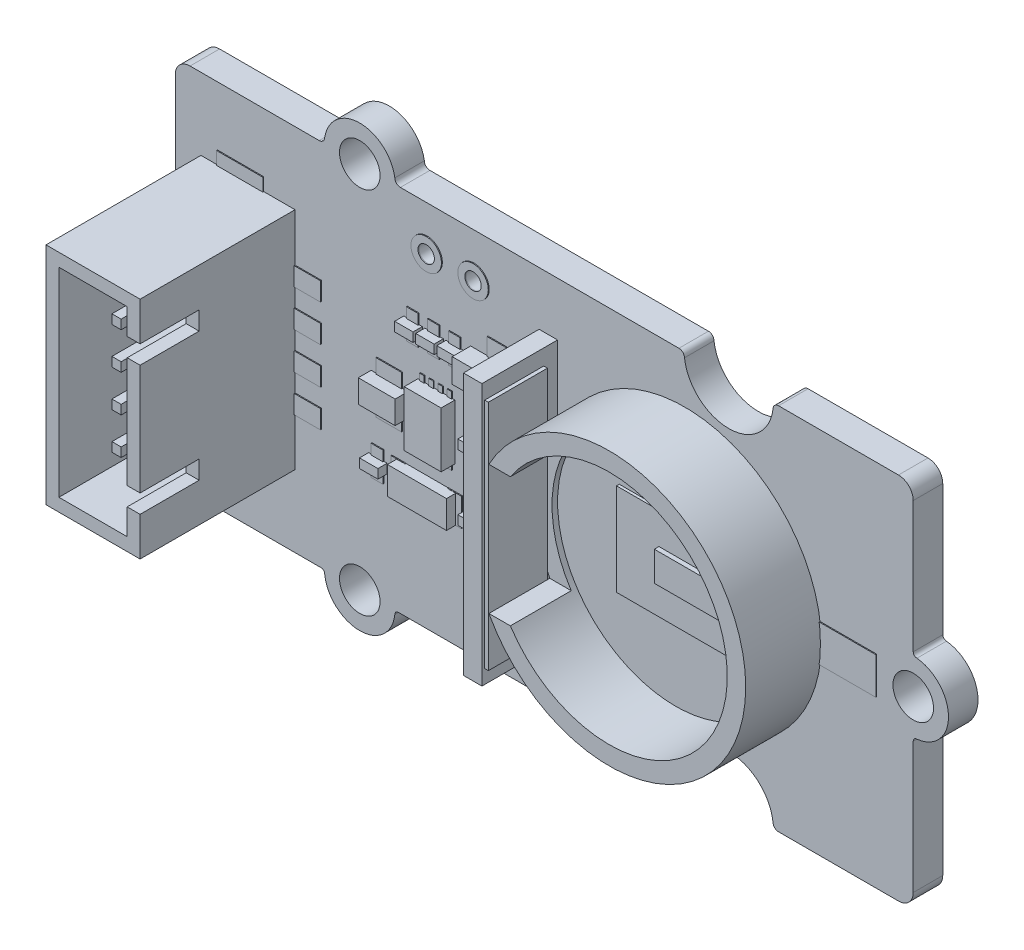
from build123d import *

# Parameters (mm, degrees)
ESQUISSE1_R                                    = 1.1
ESQUISSE1_R_2                                  = 1.100000001
ESQUISSE1_R_3                                  = 0.75
ESQUISSE1_R_4                                  = 0.4445
PCB_CONTOUR_ET_PERCAGES_EAGLE_EP_ESTIMEE_DEPTH = 1.6
CONNECTEUR_GROVE_H_ESTIMEE_START               = 1.6
ESQUISSE2_W                                    = 5.1
ESQUISSE2_H                                    = 12.2
CONNECTEUR_GROVE_H_ESTIMEE_DEPTH               = 8.4
CAVITE_GROVE_START                             = 10
ESQUISSE3_W                                    = 3.7
ESQUISSE3_H                                    = 10.8
CAVITE_GROVE_DEPTH                             = 7.3
DETROMPEURS_SIMPLIFIES_START                   = 10
ESQUISSE4_W                                    = 1
ESQUISSE4_H                                    = 1
DETROMPEURS_SIMPLIFIES_DEPTH                   = 3.2
BROCHES_GROVE_PAS2_START                       = 2.7
ESQUISSE5_W                                    = 0.5
ESQUISSE5_H                                    = 0.5
BROCHES_GROVE_PAS2_DEPTH                       = 5.9
BROCHES_GROVE_PAS2_2_DEPTH                     = 5.9
BROCHES_GROVE_PAS2_3_DEPTH                     = 5.9
BROCHES_GROVE_PAS2_4_DEPTH                     = 5.9
SUPPORT_PILE_CONTOUR_EAGLE_H4_1_START          = 1.6
ESQUISSE6_R                                    = 7.4
ESQUISSE6_R_2                                  = 6.4
SUPPORT_PILE_CONTOUR_EAGLE_H4_1_DEPTH          = 4.1
OUVERTURE_SUPPORT_ESTIMEE_START                = 5.7
ESQUISSE7_W                                    = 4
ESQUISSE7_H                                    = 7
OUVERTURE_SUPPORT_ESTIMEE_DEPTH                = 3.3
FOND_SUPPORT_SIMPLIFIE_START                   = 1.6
ESQUISSE8_R                                    = 6.4
FOND_SUPPORT_SIMPLIFIE_DEPTH                   = 0.5
DOS_SUPPORT_PILE_ESTIME_START                  = 1.6
ESQUISSE9_W                                    = 1
ESQUISSE9_H                                    = 14.2
DOS_SUPPORT_PILE_ESTIME_DEPTH                  = 4.1
CONTACT_POSITIF_SUPPORT_SIMPLIFIE_START        = 2.4
ESQUISSE10_W                                   = 0.2
ESQUISSE10_H                                   = 12.6
CONTACT_POSITIF_SUPPORT_SIMPLIFIE_DEPTH        = 3.2
CONTACT_FOND_SUPPORT_SIMPLIFIE_START           = 2.1
ESQUISSE11_W                                   = 7.7
ESQUISSE11_H                                   = 5
CONTACT_FOND_SUPPORT_SIMPLIFIE_DEPTH           = 0.15
LAME_RESSORT_SIMPLIFIEE_START                  = 2.25
ESQUISSE12_W                                   = 4.5
ESQUISSE12_H                                   = 1.6
LAME_RESSORT_SIMPLIFIEE_DEPTH                  = 0.25
X1_POSITION_EAGLE_START                        = 1.6
ESQUISSE13_W                                   = 3.2
ESQUISSE13_H                                   = 1.5
X1_POSITION_EAGLE_DEPTH                        = 0.55
U2_POSITION_EAGLE_START                        = 1.6
ESQUISSE14_W                                   = 2
ESQUISSE14_H                                   = 3
U2_POSITION_EAGLE_DEPTH                        = 0.75
C1_POSITION_EAGLE_START                        = 1.6
ESQUISSE15_W                                   = 1
ESQUISSE15_H                                   = 0.5
C1_POSITION_EAGLE_DEPTH                        = 0.5
C3_POSITION_EAGLE_START                        = 1.6
ESQUISSE16_W                                   = 1
ESQUISSE16_H                                   = 0.5
C3_POSITION_EAGLE_DEPTH                        = 0.5
R1_POSITION_EAGLE_START                        = 1.6
ESQUISSE17_W                                   = 1
ESQUISSE17_H                                   = 0.5
R1_POSITION_EAGLE_DEPTH                        = 0.5
R3_POSITION_EAGLE_START                        = 1.6
ESQUISSE18_W                                   = 1
ESQUISSE18_H                                   = 0.5
R3_POSITION_EAGLE_DEPTH                        = 0.5
U1_POSITION_EAGLE_START                        = 1.6
ESQUISSE19_W                                   = 2.9
ESQUISSE19_H                                   = 1.3
U1_POSITION_EAGLE_DEPTH                        = 1
C2_POSITION_EAGLE_START                        = 1.6
ESQUISSE20_W                                   = 1
ESQUISSE20_H                                   = 0.5
C2_POSITION_EAGLE_DEPTH                        = 0.5
R2_POSITION_EAGLE_START                        = 1.6
ESQUISSE21_W                                   = 1
ESQUISSE21_H                                   = 0.5
R2_POSITION_EAGLE_DEPTH                        = 0.5
C4_POSITION_EAGLE_START                        = 1.6
ESQUISSE22_W                                   = 2
ESQUISSE22_H                                   = 1.25
C4_POSITION_EAGLE_DEPTH                        = 0.7
PAD_X1_0_START                                 = 1.6
ESQUISSE23_W                                   = 0.762
ESQUISSE23_H                                   = 1.524
PAD_X1_0_DEPTH                                 = 0.05
PAD_X1_1_START                                 = 1.6
ESQUISSE24_W                                   = 0.762
ESQUISSE24_H                                   = 1.524
PAD_X1_1_DEPTH                                 = 0.05
PAD_J1_0_START                                 = 1.6
ESQUISSE25_W                                   = 2.5
ESQUISSE25_H                                   = 1
PAD_J1_0_DEPTH                                 = 0.05
PAD_J1_1_START                                 = 1.6
ESQUISSE26_W                                   = 2.5
ESQUISSE26_H                                   = 1
PAD_J1_1_DEPTH                                 = 0.05
PAD_J1_2_START                                 = 1.6
ESQUISSE27_W                                   = 2.5
ESQUISSE27_H                                   = 1
PAD_J1_2_DEPTH                                 = 0.05
PAD_J1_3_START                                 = 1.6
ESQUISSE28_W                                   = 2.5
ESQUISSE28_H                                   = 1
PAD_J1_3_DEPTH                                 = 0.05
PAD_J1_4_START                                 = 1.6
ESQUISSE29_W                                   = 2.5
ESQUISSE29_H                                   = 2
PAD_J1_4_DEPTH                                 = 0.05
PAD_J1_5_START                                 = 1.6
ESQUISSE30_W                                   = 2.5
ESQUISSE30_H                                   = 2
PAD_J1_5_DEPTH                                 = 0.05
PAD_U2_0_START                                 = 1.6
ESQUISSE31_W                                   = 0.25
ESQUISSE31_H                                   = 0.7
PAD_U2_0_DEPTH                                 = 0.05
PAD_U2_1_START                                 = 1.6
ESQUISSE32_W                                   = 0.25
ESQUISSE32_H                                   = 0.7
PAD_U2_1_DEPTH                                 = 0.05
PAD_U2_2_START                                 = 1.6
ESQUISSE33_W                                   = 0.25
ESQUISSE33_H                                   = 0.7
PAD_U2_2_DEPTH                                 = 0.05
PAD_U2_3_START                                 = 1.6
ESQUISSE34_W                                   = 0.25
ESQUISSE34_H                                   = 0.7
PAD_U2_3_DEPTH                                 = 0.05
PAD_U2_4_START                                 = 1.6
ESQUISSE35_W                                   = 0.25
ESQUISSE35_H                                   = 0.7
PAD_U2_4_DEPTH                                 = 0.05
PAD_U2_5_START                                 = 1.6
ESQUISSE36_W                                   = 0.25
ESQUISSE36_H                                   = 0.7
PAD_U2_5_DEPTH                                 = 0.05
PAD_U2_6_START                                 = 1.6
ESQUISSE37_W                                   = 0.25
ESQUISSE37_H                                   = 0.7
PAD_U2_6_DEPTH                                 = 0.05
PAD_U2_7_START                                 = 1.6
ESQUISSE38_W                                   = 0.25
ESQUISSE38_H                                   = 0.7
PAD_U2_7_DEPTH                                 = 0.05
PAD_U2_8_START                                 = 1.6
ESQUISSE39_W                                   = 1.5
ESQUISSE39_H                                   = 1.5
PAD_U2_8_DEPTH                                 = 0.05
PAD_C1_0_START                                 = 1.6
ESQUISSE40_W                                   = 0.635
ESQUISSE40_H                                   = 0.635
PAD_C1_0_DEPTH                                 = 0.05
PAD_C1_1_START                                 = 1.6
ESQUISSE41_W                                   = 0.635
ESQUISSE41_H                                   = 0.635
PAD_C1_1_DEPTH                                 = 0.05
PAD_C3_0_START                                 = 1.6
ESQUISSE42_W                                   = 0.635
ESQUISSE42_H                                   = 0.635
PAD_C3_0_DEPTH                                 = 0.05
PAD_C3_1_START                                 = 1.6
ESQUISSE43_W                                   = 0.635
ESQUISSE43_H                                   = 0.635
PAD_C3_1_DEPTH                                 = 0.05
PAD_R1_0_START                                 = 1.6
ESQUISSE44_W                                   = 0.635
ESQUISSE44_H                                   = 0.635
PAD_R1_0_DEPTH                                 = 0.05
PAD_R1_1_START                                 = 1.6
ESQUISSE45_W                                   = 0.635
ESQUISSE45_H                                   = 0.635
PAD_R1_1_DEPTH                                 = 0.05
PAD_R3_0_START                                 = 1.6
ESQUISSE46_W                                   = 0.635
ESQUISSE46_H                                   = 0.635
PAD_R3_0_DEPTH                                 = 0.05
PAD_R3_1_START                                 = 1.6
ESQUISSE47_W                                   = 0.635
ESQUISSE47_H                                   = 0.635
PAD_R3_1_DEPTH                                 = 0.05
PAD_U1_0_START                                 = 1.6
ESQUISSE48_W                                   = 1.016
ESQUISSE48_H                                   = 1.143
PAD_U1_0_DEPTH                                 = 0.05
PAD_U1_1_START                                 = 1.6
ESQUISSE49_W                                   = 1.016
ESQUISSE49_H                                   = 1.143
PAD_U1_1_DEPTH                                 = 0.05
PAD_U1_2_START                                 = 1.6
ESQUISSE50_W                                   = 1.016
ESQUISSE50_H                                   = 1.143
PAD_U1_2_DEPTH                                 = 0.05
PAD_C2_0_START                                 = 1.6
ESQUISSE51_W                                   = 0.635
ESQUISSE51_H                                   = 0.635
PAD_C2_0_DEPTH                                 = 0.05
PAD_C2_1_START                                 = 1.6
ESQUISSE52_W                                   = 0.635
ESQUISSE52_H                                   = 0.635
PAD_C2_1_DEPTH                                 = 0.05
PAD_R2_0_START                                 = 1.6
ESQUISSE53_W                                   = 0.635
ESQUISSE53_H                                   = 0.635
PAD_R2_0_DEPTH                                 = 0.05
PAD_R2_1_START                                 = 1.6
ESQUISSE54_W                                   = 0.635
ESQUISSE54_H                                   = 0.635
PAD_R2_1_DEPTH                                 = 0.05
PAD_BAT1_0_START                               = 1.6
ESQUISSE55_W                                   = 4.4
ESQUISSE55_H                                   = 2
PAD_BAT1_0_DEPTH                               = 0.05
PAD_BAT1_1_START                               = 1.6
ESQUISSE56_W                                   = 4.4
ESQUISSE56_H                                   = 2
PAD_BAT1_1_DEPTH                               = 0.05
PAD_C4_0_START                                 = 1.6
ESQUISSE57_W                                   = 1.397
ESQUISSE57_H                                   = 1.016
PAD_C4_0_DEPTH                                 = 0.05
PAD_C4_1_START                                 = 1.6
ESQUISSE58_W                                   = 1.397
ESQUISSE58_H                                   = 1.016
PAD_C4_1_DEPTH                                 = 0.05
ANNEAUX_CLK_INT_START                          = 1.6
ESQUISSE59_R                                   = 0.8255
ESQUISSE59_R_2                                 = 0.4445
ANNEAUX_CLK_INT_DEPTH                          = 0.05
ANNEAUX_CLK_INT_2_DEPTH                        = 0.05


with BuildPart() as part:
    # Esquisse1 → PCB_contour_et_percages_Eagle_ep_ESTIMEE_1_6 (new body)
    with BuildSketch(Plane.XY):
        with BuildLine():
            Line((20.635, -9.2), (20.635, -2.1))
            ThreePointArc((20.635, -2.1), (20.693578644, -1.958578644), (20.835, -1.9))
            ThreePointArc((20.835, -1.9), (22.545497316, 0), (20.835, 1.9))
            ThreePointArc((20.835, 1.9), (20.693578644, 1.958578644), (20.635, 2.1))
            Line((20.635, 2.1), (20.635, 9.2))
            ThreePointArc((20.635, 9.2), (20.400685425, 9.765685425), (19.835, 10))
            Line((19.835, 10), (13.335, 10))
            ThreePointArc((13.335, 10), (13.122867966, 9.912132034), (13.035, 9.7))
            ThreePointArc((13.035, 9.7), (10.635, 7.581322681), (8.235, 9.7))
            ThreePointArc((8.235, 9.7), (8.147132034, 9.912132034), (7.935, 10))
            Line((7.935, 10), (-7.165, 10))
            ThreePointArc((-7.165, 10), (-7.377132034, 10.087867966), (-7.465, 10.3))
            ThreePointArc((-7.465, 10.3), (-9.365, 11.923538409), (-11.265, 10.3))
            ThreePointArc((-11.265, 10.3), (-11.352867966, 10.087867966), (-11.565, 10))
            Line((-11.565, 10), (-18.565, 10))
            ThreePointArc((-18.565, 10), (-19.130685425, 9.765685425), (-19.365, 9.2))
            Line((-19.365, 9.2), (-19.365, 2.7))
            ThreePointArc((-19.365, 2.7), (-19.277132034, 2.487867966), (-19.065, 2.4))
            ThreePointArc((-19.065, 2.4), (-16.946322681, 0), (-19.065, -2.4))
            ThreePointArc((-19.065, -2.4), (-19.277132034, -2.487867966), (-19.365, -2.7))
            Line((-19.365, -2.7), (-19.365, -9.2))
            ThreePointArc((-19.365, -9.2), (-19.130685425, -9.765685425), (-18.565, -10))
            Line((-18.565, -10), (-11.465, -10))
            ThreePointArc((-11.465, -10), (-11.323578644, -10.058578644), (-11.265, -10.2))
            ThreePointArc((-11.265, -10.2), (-9.365, -11.910497316), (-7.465, -10.2))
            ThreePointArc((-7.465, -10.2), (-7.406421356, -10.058578644), (-7.265, -10))
            Line((-7.265, -10), (7.935, -10))
            ThreePointArc((7.935, -10), (8.147132034, -9.912132034), (8.235, -9.7))
            ThreePointArc((8.235, -9.7), (10.635, -7.581322681), (13.035, -9.7))
            ThreePointArc((13.035, -9.7), (13.122867966, -9.912132034), (13.335, -10))
            Line((13.335, -10), (19.835, -10))
            ThreePointArc((19.835, -10), (20.400685425, -9.765685425), (20.635, -9.2))
        make_face()
        with Locations((-9.365, -9.999999999)):
            Circle(ESQUISSE1_R, mode=Mode.SUBTRACT)
        with Locations((-9.365, 10.000000004)):
            Circle(ESQUISSE1_R, mode=Mode.SUBTRACT)
        with Locations((20.634999999, 0)):
            Circle(ESQUISSE1_R_2, mode=Mode.SUBTRACT)
        with Locations((4.555, 0)):
            Circle(ESQUISSE1_R_3, mode=Mode.SUBTRACT)
        with Locations((11.955, 0)):
            Circle(ESQUISSE1_R_3, mode=Mode.SUBTRACT)
        with Locations((-3.175, 7.62)):
            Circle(ESQUISSE1_R_4, mode=Mode.SUBTRACT)
        with Locations((-5.715, 7.62)):
            Circle(ESQUISSE1_R_4, mode=Mode.SUBTRACT)
    extrude(amount=PCB_CONTOUR_ET_PERCAGES_EAGLE_EP_ESTIMEE_DEPTH)


with BuildPart() as body_2:
    # Esquisse2 → Connecteur_Grove_H_ESTIMEE (new body)
    with BuildSketch(Plane.XY.offset(CONNECTEUR_GROVE_H_ESTIMEE_START)):
        with Locations((-15.423, 0)):
            Rectangle(ESQUISSE2_W, ESQUISSE2_H)
    extrude(amount=CONNECTEUR_GROVE_H_ESTIMEE_DEPTH)

    # Esquisse3 → Cavite_Grove (cut)
    with BuildSketch(Plane.XY.offset(CAVITE_GROVE_START)):
        with Locations((-15.423, 0)):
            Rectangle(ESQUISSE3_W, ESQUISSE3_H)
    extrude(amount=-CAVITE_GROVE_DEPTH, mode=Mode.SUBTRACT)

    # Esquisse4 → Detrompeurs_simplifies (cut)
    with BuildSketch(Plane.XY.offset(DETROMPEURS_SIMPLIFIES_START)):
        with Locations((-13.173, -3.5)):
            Rectangle(ESQUISSE4_W, ESQUISSE4_H)
        with Locations((-13.173, 3.5)):
            Rectangle(ESQUISSE4_W, ESQUISSE4_H)
    extrude(amount=-DETROMPEURS_SIMPLIFIES_DEPTH, mode=Mode.SUBTRACT)


with BuildPart() as body_3:
    # Esquisse5 → Broches_Grove_pas2 (new body)
    with BuildSketch(Plane.XY.offset(BROCHES_GROVE_PAS2_START)):
        with Locations((-15.55, -3)):
            Rectangle(ESQUISSE5_W, ESQUISSE5_H)
    extrude(amount=BROCHES_GROVE_PAS2_DEPTH)


with BuildPart() as body_4:
    # Esquisse5 → Broches_Grove_pas2 2 (new body)
    with BuildSketch(Plane.XY.offset(BROCHES_GROVE_PAS2_START)):
        with Locations((-15.55, -1)):
            Rectangle(ESQUISSE5_W, ESQUISSE5_H)
    extrude(amount=BROCHES_GROVE_PAS2_2_DEPTH)


with BuildPart() as body_5:
    # Esquisse5 → Broches_Grove_pas2 3 (new body)
    with BuildSketch(Plane.XY.offset(BROCHES_GROVE_PAS2_START)):
        with Locations((-15.55, 1)):
            Rectangle(ESQUISSE5_W, ESQUISSE5_H)
    extrude(amount=BROCHES_GROVE_PAS2_3_DEPTH)


with BuildPart() as body_6:
    # Esquisse5 → Broches_Grove_pas2 4 (new body)
    with BuildSketch(Plane.XY.offset(BROCHES_GROVE_PAS2_START)):
        with Locations((-15.55, 3)):
            Rectangle(ESQUISSE5_W, ESQUISSE5_H)
    extrude(amount=BROCHES_GROVE_PAS2_4_DEPTH)


with BuildPart() as body_7:
    # Esquisse6 → Support_pile_contour_Eagle_H4_1 (new body)
    with BuildSketch(Plane.XY.offset(SUPPORT_PILE_CONTOUR_EAGLE_H4_1_START)):
        with Locations((8.255, 0)):
            Circle(ESQUISSE6_R)
        with Locations((8.255, 0)):
            Circle(ESQUISSE6_R_2, mode=Mode.SUBTRACT)
    extrude(amount=SUPPORT_PILE_CONTOUR_EAGLE_H4_1_DEPTH)

    # Esquisse7 → Ouverture_support_ESTIMEE (cut)
    with BuildSketch(Plane.XY.offset(OUVERTURE_SUPPORT_ESTIMEE_START)):
        with Locations((2.2, 0)):
            Rectangle(ESQUISSE7_W, ESQUISSE7_H)
    extrude(amount=-OUVERTURE_SUPPORT_ESTIMEE_DEPTH, mode=Mode.SUBTRACT)


with BuildPart() as body_8:
    # Esquisse8 → Fond_support_simplifie (new body)
    with BuildSketch(Plane.XY.offset(FOND_SUPPORT_SIMPLIFIE_START)):
        with Locations((8.255, 0)):
            Circle(ESQUISSE8_R)
    extrude(amount=FOND_SUPPORT_SIMPLIFIE_DEPTH)


with BuildPart() as body_9:
    # Esquisse9 → Dos_support_pile_ESTIME (new body)
    with BuildSketch(Plane.XY.offset(DOS_SUPPORT_PILE_ESTIME_START)):
        with Locations((0.855, 0)):
            Rectangle(ESQUISSE9_W, ESQUISSE9_H)
    extrude(amount=DOS_SUPPORT_PILE_ESTIME_DEPTH)


with BuildPart() as body_10:
    # Esquisse10 → Contact_positif_support_simplifie (new body)
    with BuildSketch(Plane.XY.offset(CONTACT_POSITIF_SUPPORT_SIMPLIFIE_START)):
        with Locations((1.505, 0)):
            Rectangle(ESQUISSE10_W, ESQUISSE10_H)
    extrude(amount=CONTACT_POSITIF_SUPPORT_SIMPLIFIE_DEPTH)


with BuildPart() as body_11:
    # Esquisse11 → Contact_fond_support_simplifie (new body)
    with BuildSketch(Plane.XY.offset(CONTACT_FOND_SUPPORT_SIMPLIFIE_START)):
        with Locations((9.05, 0)):
            Rectangle(ESQUISSE11_W, ESQUISSE11_H)
    extrude(amount=CONTACT_FOND_SUPPORT_SIMPLIFIE_DEPTH)


with BuildPart() as body_12:
    # Esquisse12 → Lame_ressort_simplifiee (new body)
    with BuildSketch(Plane.XY.offset(LAME_RESSORT_SIMPLIFIEE_START)):
        with Locations((9.75, 0)):
            Rectangle(ESQUISSE12_W, ESQUISSE12_H)
    extrude(amount=LAME_RESSORT_SIMPLIFIEE_DEPTH)


with BuildPart() as body_13:
    # Esquisse13 → X1_position_Eagle (new body)
    with BuildSketch(Plane.XY.offset(X1_POSITION_EAGLE_START)):
        with Locations((-5.715, -3.556)):
            Rectangle(ESQUISSE13_W, ESQUISSE13_H)
    extrude(amount=X1_POSITION_EAGLE_DEPTH)


with BuildPart() as body_14:
    # Esquisse14 → U2_position_Eagle (new body)
    with BuildSketch(Plane.XY.offset(U2_POSITION_EAGLE_START)):
        with Locations((-5.207, 0)):
            Rectangle(ESQUISSE14_W, ESQUISSE14_H)
    extrude(amount=U2_POSITION_EAGLE_DEPTH)


with BuildPart() as body_15:
    # Esquisse15 → C1_position_Eagle (new body)
    with BuildSketch(Plane.XY.offset(C1_POSITION_EAGLE_START)):
        with Locations((-8.382, -3.556)):
            Rectangle(ESQUISSE15_W, ESQUISSE15_H)
    extrude(amount=C1_POSITION_EAGLE_DEPTH)


with BuildPart() as body_16:
    # Esquisse16 → C3_position_Eagle (new body)
    with BuildSketch(Plane.XY.offset(C3_POSITION_EAGLE_START)):
        with Locations((-3.048, -3.556)):
            Rectangle(ESQUISSE16_W, ESQUISSE16_H)
    extrude(amount=C3_POSITION_EAGLE_DEPTH)


with BuildPart() as body_17:
    # Esquisse17 → R1_position_Eagle (new body)
    with BuildSketch(Plane.XY.offset(R1_POSITION_EAGLE_START)):
        with Locations((-5.334, 3.81)):
            Rectangle(ESQUISSE17_W, ESQUISSE17_H)
    extrude(amount=R1_POSITION_EAGLE_DEPTH)


with BuildPart() as body_18:
    # Esquisse18 → R3_position_Eagle (new body)
    with BuildSketch(Plane.XY.offset(R3_POSITION_EAGLE_START)):
        with Locations((-3.048, 0)):
            Rectangle(ESQUISSE18_W, ESQUISSE18_H)
    extrude(amount=R3_POSITION_EAGLE_DEPTH)


with BuildPart() as body_19:
    # Esquisse19 → U1_position_Eagle (new body)
    with BuildSketch(Plane.XY.offset(U1_POSITION_EAGLE_START)):
        with Locations((-1.905, 3.81)):
            Rectangle(ESQUISSE19_W, ESQUISSE19_H)
    extrude(amount=U1_POSITION_EAGLE_DEPTH)


with BuildPart() as body_20:
    # Esquisse20 → C2_position_Eagle (new body)
    with BuildSketch(Plane.XY.offset(C2_POSITION_EAGLE_START)):
        with Locations((-6.477, 3.81)):
            Rectangle(ESQUISSE20_W, ESQUISSE20_H)
    extrude(amount=C2_POSITION_EAGLE_DEPTH)


with BuildPart() as body_21:
    # Esquisse21 → R2_position_Eagle (new body)
    with BuildSketch(Plane.XY.offset(R2_POSITION_EAGLE_START)):
        with Locations((-4.191, 3.81)):
            Rectangle(ESQUISSE21_W, ESQUISSE21_H)
    extrude(amount=R2_POSITION_EAGLE_DEPTH)


with BuildPart() as body_22:
    # Esquisse22 → C4_position_Eagle (new body)
    with BuildSketch(Plane.XY.offset(C4_POSITION_EAGLE_START)):
        with Locations((-7.747, 0)):
            Rectangle(ESQUISSE22_W, ESQUISSE22_H)
    extrude(amount=C4_POSITION_EAGLE_DEPTH)


with BuildPart() as body_23:
    # Esquisse23 → Pad_X1_0 (new body)
    with BuildSketch(Plane.XY.offset(PAD_X1_0_START)):
        with Locations((-4.191, -3.556)):
            Rectangle(ESQUISSE23_W, ESQUISSE23_H)
    extrude(amount=PAD_X1_0_DEPTH)


with BuildPart() as body_24:
    # Esquisse24 → Pad_X1_1 (new body)
    with BuildSketch(Plane.XY.offset(PAD_X1_1_START)):
        with Locations((-7.239, -3.556)):
            Rectangle(ESQUISSE24_W, ESQUISSE24_H)
    extrude(amount=PAD_X1_1_DEPTH)


with BuildPart() as body_25:
    # Esquisse25 → Pad_J1_0 (new body)
    with BuildSketch(Plane.XY.offset(PAD_J1_0_START)):
        with Locations((-12.7, -3)):
            Rectangle(ESQUISSE25_W, ESQUISSE25_H)
    extrude(amount=PAD_J1_0_DEPTH)


with BuildPart() as body_26:
    # Esquisse26 → Pad_J1_1 (new body)
    with BuildSketch(Plane.XY.offset(PAD_J1_1_START)):
        with Locations((-12.7, -1)):
            Rectangle(ESQUISSE26_W, ESQUISSE26_H)
    extrude(amount=PAD_J1_1_DEPTH)


with BuildPart() as body_27:
    # Esquisse27 → Pad_J1_2 (new body)
    with BuildSketch(Plane.XY.offset(PAD_J1_2_START)):
        with Locations((-12.7, 1)):
            Rectangle(ESQUISSE27_W, ESQUISSE27_H)
    extrude(amount=PAD_J1_2_DEPTH)


with BuildPart() as body_28:
    # Esquisse28 → Pad_J1_3 (new body)
    with BuildSketch(Plane.XY.offset(PAD_J1_3_START)):
        with Locations((-12.7, 3)):
            Rectangle(ESQUISSE28_W, ESQUISSE28_H)
    extrude(amount=PAD_J1_3_DEPTH)


with BuildPart() as body_29:
    # Esquisse29 → Pad_J1_4 (new body)
    with BuildSketch(Plane.XY.offset(PAD_J1_4_START)):
        with Locations((-15.823, -5.8)):
            Rectangle(ESQUISSE29_W, ESQUISSE29_H)
    extrude(amount=PAD_J1_4_DEPTH)


with BuildPart() as body_30:
    # Esquisse30 → Pad_J1_5 (new body)
    with BuildSketch(Plane.XY.offset(PAD_J1_5_START)):
        with Locations((-15.823, 5.8)):
            Rectangle(ESQUISSE30_W, ESQUISSE30_H)
    extrude(amount=PAD_J1_5_DEPTH)


with BuildPart() as body_31:
    # Esquisse31 → Pad_U2_0 (new body)
    with BuildSketch(Plane.XY.offset(PAD_U2_0_START)):
        with Locations((-5.957, -1.5)):
            Rectangle(ESQUISSE31_W, ESQUISSE31_H)
    extrude(amount=PAD_U2_0_DEPTH)


with BuildPart() as body_32:
    # Esquisse32 → Pad_U2_1 (new body)
    with BuildSketch(Plane.XY.offset(PAD_U2_1_START)):
        with Locations((-5.457, -1.5)):
            Rectangle(ESQUISSE32_W, ESQUISSE32_H)
    extrude(amount=PAD_U2_1_DEPTH)


with BuildPart() as body_33:
    # Esquisse33 → Pad_U2_2 (new body)
    with BuildSketch(Plane.XY.offset(PAD_U2_2_START)):
        with Locations((-4.957, -1.5)):
            Rectangle(ESQUISSE33_W, ESQUISSE33_H)
    extrude(amount=PAD_U2_2_DEPTH)


with BuildPart() as body_34:
    # Esquisse34 → Pad_U2_3 (new body)
    with BuildSketch(Plane.XY.offset(PAD_U2_3_START)):
        with Locations((-4.457, -1.5)):
            Rectangle(ESQUISSE34_W, ESQUISSE34_H)
    extrude(amount=PAD_U2_3_DEPTH)


with BuildPart() as body_35:
    # Esquisse35 → Pad_U2_4 (new body)
    with BuildSketch(Plane.XY.offset(PAD_U2_4_START)):
        with Locations((-4.457, 1.5)):
            Rectangle(ESQUISSE35_W, ESQUISSE35_H)
    extrude(amount=PAD_U2_4_DEPTH)


with BuildPart() as body_36:
    # Esquisse36 → Pad_U2_5 (new body)
    with BuildSketch(Plane.XY.offset(PAD_U2_5_START)):
        with Locations((-4.957, 1.5)):
            Rectangle(ESQUISSE36_W, ESQUISSE36_H)
    extrude(amount=PAD_U2_5_DEPTH)


with BuildPart() as body_37:
    # Esquisse37 → Pad_U2_6 (new body)
    with BuildSketch(Plane.XY.offset(PAD_U2_6_START)):
        with Locations((-5.457, 1.5)):
            Rectangle(ESQUISSE37_W, ESQUISSE37_H)
    extrude(amount=PAD_U2_6_DEPTH)


with BuildPart() as body_38:
    # Esquisse38 → Pad_U2_7 (new body)
    with BuildSketch(Plane.XY.offset(PAD_U2_7_START)):
        with Locations((-5.957, 1.5)):
            Rectangle(ESQUISSE38_W, ESQUISSE38_H)
    extrude(amount=PAD_U2_7_DEPTH)


with BuildPart() as body_39:
    # Esquisse39 → Pad_U2_8 (new body)
    with BuildSketch(Plane.XY.offset(PAD_U2_8_START)):
        with Locations((-5.207, 0)):
            Rectangle(ESQUISSE39_W, ESQUISSE39_H)
    extrude(amount=PAD_U2_8_DEPTH)


with BuildPart() as body_40:
    # Esquisse40 → Pad_C1_0 (new body)
    with BuildSketch(Plane.XY.offset(PAD_C1_0_START)):
        with Locations((-8.382, -4.0405)):
            Rectangle(ESQUISSE40_W, ESQUISSE40_H)
    extrude(amount=PAD_C1_0_DEPTH)


with BuildPart() as body_41:
    # Esquisse41 → Pad_C1_1 (new body)
    with BuildSketch(Plane.XY.offset(PAD_C1_1_START)):
        with Locations((-8.382, -3.0715)):
            Rectangle(ESQUISSE41_W, ESQUISSE41_H)
    extrude(amount=PAD_C1_1_DEPTH)


with BuildPart() as body_42:
    # Esquisse42 → Pad_C3_0 (new body)
    with BuildSketch(Plane.XY.offset(PAD_C3_0_START)):
        with Locations((-3.048, -4.0405)):
            Rectangle(ESQUISSE42_W, ESQUISSE42_H)
    extrude(amount=PAD_C3_0_DEPTH)


with BuildPart() as body_43:
    # Esquisse43 → Pad_C3_1 (new body)
    with BuildSketch(Plane.XY.offset(PAD_C3_1_START)):
        with Locations((-3.048, -3.0715)):
            Rectangle(ESQUISSE43_W, ESQUISSE43_H)
    extrude(amount=PAD_C3_1_DEPTH)


with BuildPart() as body_44:
    # Esquisse44 → Pad_R1_0 (new body)
    with BuildSketch(Plane.XY.offset(PAD_R1_0_START)):
        with Locations((-5.334, 3.3255)):
            Rectangle(ESQUISSE44_W, ESQUISSE44_H)
    extrude(amount=PAD_R1_0_DEPTH)


with BuildPart() as body_45:
    # Esquisse45 → Pad_R1_1 (new body)
    with BuildSketch(Plane.XY.offset(PAD_R1_1_START)):
        with Locations((-5.334, 4.2945)):
            Rectangle(ESQUISSE45_W, ESQUISSE45_H)
    extrude(amount=PAD_R1_1_DEPTH)


with BuildPart() as body_46:
    # Esquisse46 → Pad_R3_0 (new body)
    with BuildSketch(Plane.XY.offset(PAD_R3_0_START)):
        with Locations((-3.048, 0.4845)):
            Rectangle(ESQUISSE46_W, ESQUISSE46_H)
    extrude(amount=PAD_R3_0_DEPTH)


with BuildPart() as body_47:
    # Esquisse47 → Pad_R3_1 (new body)
    with BuildSketch(Plane.XY.offset(PAD_R3_1_START)):
        with Locations((-3.048, -0.4845)):
            Rectangle(ESQUISSE47_W, ESQUISSE47_H)
    extrude(amount=PAD_R3_1_DEPTH)


with BuildPart() as body_48:
    # Esquisse48 → Pad_U1_0 (new body)
    with BuildSketch(Plane.XY.offset(PAD_U1_0_START)):
        with Locations((-1.905, 4.826)):
            Rectangle(ESQUISSE48_W, ESQUISSE48_H)
    extrude(amount=PAD_U1_0_DEPTH)


with BuildPart() as body_49:
    # Esquisse49 → Pad_U1_1 (new body)
    with BuildSketch(Plane.XY.offset(PAD_U1_1_START)):
        with Locations((-1.016, 2.794)):
            Rectangle(ESQUISSE49_W, ESQUISSE49_H)
    extrude(amount=PAD_U1_1_DEPTH)


with BuildPart() as body_50:
    # Esquisse50 → Pad_U1_2 (new body)
    with BuildSketch(Plane.XY.offset(PAD_U1_2_START)):
        with Locations((-2.794, 2.794)):
            Rectangle(ESQUISSE50_W, ESQUISSE50_H)
    extrude(amount=PAD_U1_2_DEPTH)


with BuildPart() as body_51:
    # Esquisse51 → Pad_C2_0 (new body)
    with BuildSketch(Plane.XY.offset(PAD_C2_0_START)):
        with Locations((-6.477, 3.3255)):
            Rectangle(ESQUISSE51_W, ESQUISSE51_H)
    extrude(amount=PAD_C2_0_DEPTH)


with BuildPart() as body_52:
    # Esquisse52 → Pad_C2_1 (new body)
    with BuildSketch(Plane.XY.offset(PAD_C2_1_START)):
        with Locations((-6.477, 4.2945)):
            Rectangle(ESQUISSE52_W, ESQUISSE52_H)
    extrude(amount=PAD_C2_1_DEPTH)


with BuildPart() as body_53:
    # Esquisse53 → Pad_R2_0 (new body)
    with BuildSketch(Plane.XY.offset(PAD_R2_0_START)):
        with Locations((-4.191, 3.3255)):
            Rectangle(ESQUISSE53_W, ESQUISSE53_H)
    extrude(amount=PAD_R2_0_DEPTH)


with BuildPart() as body_54:
    # Esquisse54 → Pad_R2_1 (new body)
    with BuildSketch(Plane.XY.offset(PAD_R2_1_START)):
        with Locations((-4.191, 4.2945)):
            Rectangle(ESQUISSE54_W, ESQUISSE54_H)
    extrude(amount=PAD_R2_1_DEPTH)


with BuildPart() as body_55:
    # Esquisse55 → Pad_BAT1_0 (new body)
    with BuildSketch(Plane.XY.offset(PAD_BAT1_0_START)):
        with Locations((0.055, 0)):
            Rectangle(ESQUISSE55_W, ESQUISSE55_H)
    extrude(amount=PAD_BAT1_0_DEPTH)


with BuildPart() as body_56:
    # Esquisse56 → Pad_BAT1_1 (new body)
    with BuildSketch(Plane.XY.offset(PAD_BAT1_1_START)):
        with Locations((16.455, 0)):
            Rectangle(ESQUISSE56_W, ESQUISSE56_H)
    extrude(amount=PAD_BAT1_1_DEPTH)


with BuildPart() as body_57:
    # Esquisse57 → Pad_C4_0 (new body)
    with BuildSketch(Plane.XY.offset(PAD_C4_0_START)):
        with Locations((-7.747, -0.889)):
            Rectangle(ESQUISSE57_W, ESQUISSE57_H)
    extrude(amount=PAD_C4_0_DEPTH)


with BuildPart() as body_58:
    # Esquisse58 → Pad_C4_1 (new body)
    with BuildSketch(Plane.XY.offset(PAD_C4_1_START)):
        with Locations((-7.747, 0.889)):
            Rectangle(ESQUISSE58_W, ESQUISSE58_H)
    extrude(amount=PAD_C4_1_DEPTH)


with BuildPart() as body_59:
    # Esquisse59 → Anneaux_CLK_INT (new body)
    with BuildSketch(Plane.XY.offset(ANNEAUX_CLK_INT_START)):
        with Locations((-3.175, 7.62)):
            Circle(ESQUISSE59_R)
        with Locations((-3.175, 7.62)):
            Circle(ESQUISSE59_R_2, mode=Mode.SUBTRACT)
    extrude(amount=ANNEAUX_CLK_INT_DEPTH)


with BuildPart() as body_60:
    # Esquisse59 → Anneaux_CLK_INT 2 (new body)
    with BuildSketch(Plane.XY.offset(ANNEAUX_CLK_INT_START)):
        with Locations((-5.715, 7.62)):
            Circle(ESQUISSE59_R)
        with Locations((-5.715, 7.62)):
            Circle(ESQUISSE59_R_2, mode=Mode.SUBTRACT)
    extrude(amount=ANNEAUX_CLK_INT_2_DEPTH)


solid = Compound([part.part, body_2.part, body_3.part, body_4.part, body_5.part, body_6.part, body_7.part, body_8.part, body_9.part, body_10.part, body_11.part, body_12.part, body_13.part, body_14.part, body_15.part, body_16.part, body_17.part, body_18.part, body_19.part, body_20.part, body_21.part, body_22.part, body_23.part, body_24.part, body_25.part, body_26.part, body_27.part, body_28.part, body_29.part, body_30.part, body_31.part, body_32.part, body_33.part, body_34.part, body_35.part, body_36.part, body_37.part, body_38.part, body_39.part, body_40.part, body_41.part, body_42.part, body_43.part, body_44.part, body_45.part, body_46.part, body_47.part, body_48.part, body_49.part, body_50.part, body_51.part, body_52.part, body_53.part, body_54.part, body_55.part, body_56.part, body_57.part, body_58.part, body_59.part, body_60.part])
